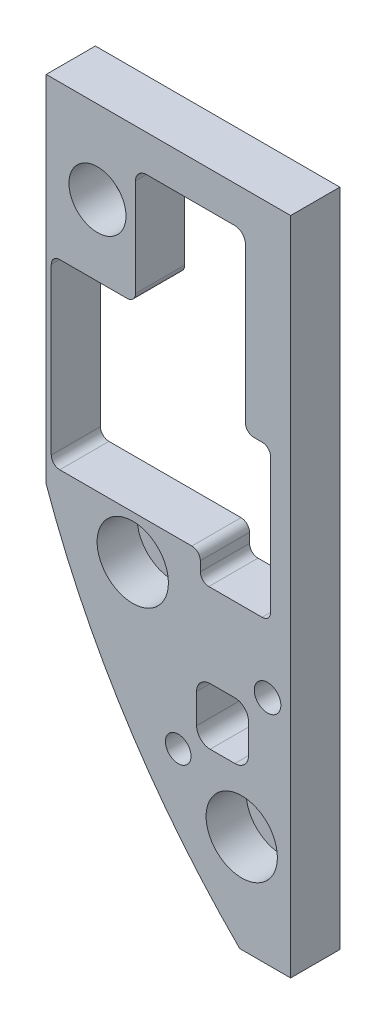
from build123d import *

# Parameters (mm, degrees)
SKETCH1_R           = 2.15265
SKETCH1_R_2         = 2.487009827
SKETCH1_R_3         = 2.39450721
BOSS_EXTRUDE1_DEPTH = 10.8
SKETCH3_R           = 6.6675
SKETCH3_R_2         = 5.334
CUT_EXTRUDE1_DEPTH  = 7.5
CUT_EXTRUDE2_DEPTH  = 1.6
SKETCH5_W           = 9.708458893
SKETCH5_H           = 10.633336146
CUT_EXTRUDE3_DEPTH  = 149.78546991
FILLET1_R           = 2.54


with BuildPart() as part:
    # Sketch1 → Boss-Extrude1 (new body)
    with BuildSketch(Plane.XY):
        with BuildLine():
            Line((0, -17.78), (-45.72, -17.78))
            Line((-45.72, -17.78), (-45.72, -84.1375))
            ThreePointArc((-45.72, -84.1375), (-30.833523511, -114.746148224), (-9.525, -141.2875))
            Line((-9.525, -141.2875), (0, -141.2875))
            Line((0, -141.2875), (0, -17.78))
        make_face()
        with Locations((-36.1315, -33.274)):
            Circle(SKETCH1_R, mode=Mode.SUBTRACT)
        with Locations((-9.144, -122.9995)):
            Circle(SKETCH1_R, mode=Mode.SUBTRACT)
        with Locations((-4.3173518, -98.035919174)):
            Circle(SKETCH1_R_2, mode=Mode.SUBTRACT)
        with Locations((-21.024674116, -114.680376144)):
            Circle(SKETCH1_R_3, mode=Mode.SUBTRACT)
        with BuildLine():
            Line((-30.5943, -46.501483685), (-43.185677441, -46.501483685))
            ThreePointArc((-43.185677441, -46.501483685), (-44.308209457, -46.96645167), (-44.773177441, -48.088983685))
            Line((-44.773177441, -48.088983685), (-44.773177441, -78.965225138))
            ThreePointArc((-44.773177441, -78.965225138), (-44.308209457, -80.087757153), (-43.185677441, -80.552725138))
            Line((-43.185677441, -80.552725138), (-18.474223541, -80.552725138))
            ThreePointArc((-18.474223541, -80.552725138), (-17.351691526, -81.017693123), (-16.886723541, -82.140225138))
            Line((-16.886723541, -82.140225138), (-16.886723541, -83.937143103))
            ThreePointArc((-16.886723541, -83.937143103), (-16.421755557, -85.059675118), (-15.299223541, -85.524643103))
            Line((-15.299223541, -85.524643103), (-5.327492268, -85.524643103))
            ThreePointArc((-5.327492268, -85.524643103), (-4.204960252, -85.059675118), (-3.739992268, -83.937143103))
            Line((-3.739992268, -83.937143103), (-3.739992268, -58.7502))
            ThreePointArc((-3.739992268, -58.7502), (-4.204960252, -57.627667985), (-5.327492268, -57.1627))
            Line((-5.327492268, -57.1627), (-6.8707, -57.1627))
            ThreePointArc((-6.8707, -57.1627), (-7.993232015, -56.697732015), (-8.4582, -55.5752))
            Line((-8.4582, -55.5752), (-8.4582, -26.6573))
            ThreePointArc((-8.4582, -26.6573), (-9.053359021, -25.220459021), (-10.4902, -24.6253))
            Line((-10.4902, -24.6253), (-26.9748, -24.6253))
            ThreePointArc((-26.9748, -24.6253), (-28.411640979, -25.220459021), (-29.0068, -26.6573))
            Line((-29.0068, -26.6573), (-29.0068, -44.913983685))
            ThreePointArc((-29.0068, -44.913983685), (-29.471767985, -46.036515701), (-30.5943, -46.501483685))
        make_face(mode=Mode.SUBTRACT)
    extrude(amount=BOSS_EXTRUDE1_DEPTH)

    # Sketch3 → Cut-Extrude1 (cut)
    with BuildSketch(Plane.XY.offset(10.8)):
        with Locations((-9.144, -122.9995)):
            Circle(SKETCH3_R)
        with Locations((-29.5275, -88.7095)):
            Circle(SKETCH3_R)
        with Locations((-36.1315, -33.274)):
            Circle(SKETCH3_R_2)
    extrude(amount=-CUT_EXTRUDE1_DEPTH, mode=Mode.SUBTRACT)

    # Sketch4 → Cut-Extrude2 (cut)
    with BuildSketch(Plane(origin=(0, 0, 0), x_dir=(-1, 0, 0), z_dir=(0, 0, -1))):
        with BuildLine():
            Line((0, -17.78), (0, -141.2875))
            Line((0, -141.2875), (9.525, -141.2875))
            ThreePointArc((9.525, -141.2875), (30.833523511, -114.746148224), (45.72, -84.1375))
            Line((45.72, -84.1375), (45.72, -17.78))
            Line((45.72, -17.78), (0, -17.78))
        make_face()
    extrude(amount=-CUT_EXTRUDE2_DEPTH, mode=Mode.SUBTRACT)

    # Sketch5 → Cut-Extrude3 (cut, through all)
    with BuildSketch(Plane.XY.offset(10.8)):
        with Locations((-12.736000001, -106.4375)):
            Rectangle(SKETCH5_W, SKETCH5_H)
    extrude(amount=-CUT_EXTRUDE3_DEPTH, mode=Mode.SUBTRACT)

    # Fillet1
    fillet1_edges = [part.edges().sort_by_distance(p)[0] for p in [
        (-7.881770554, -101.120831927, 6.2),
        (-17.590229447, -101.120831927, 6.2),
        (-17.590229447, -111.754168073, 6.2),
        (-7.881770554, -111.754168073, 6.2),
    ]]
    fillet(fillet1_edges, radius=FILLET1_R)


solid = part.part
